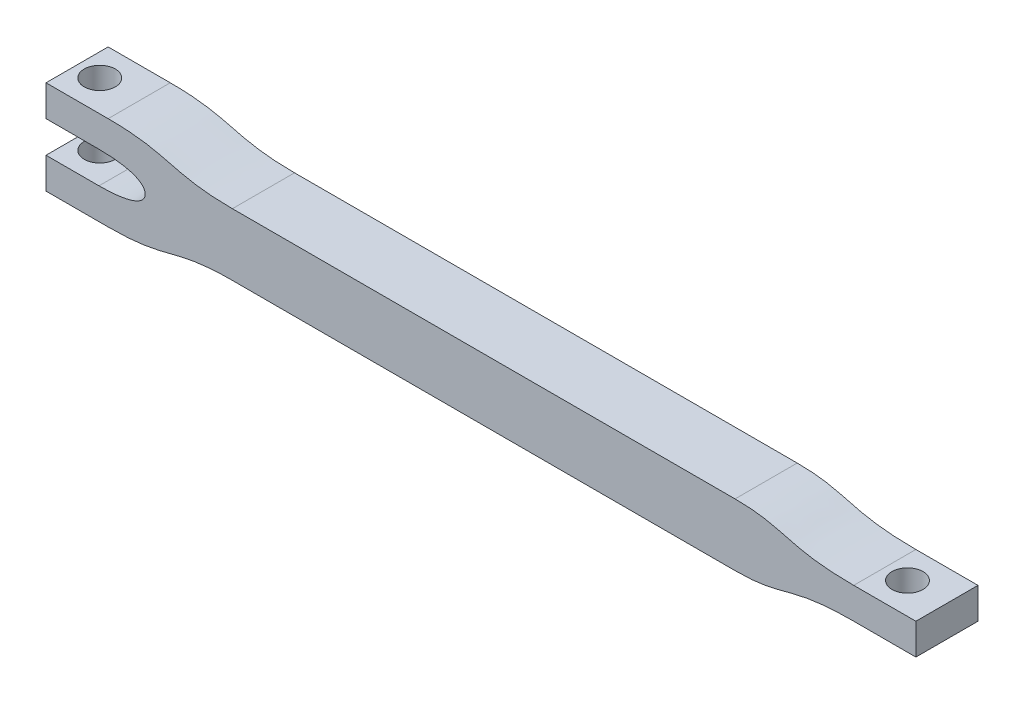
from build123d import *

# Parameters (mm, degrees)
BOSS_EXTRUDE1_DEPTH = 25.4
SKETCH4_R           = 6.35
CUT_EXTRUDE2_DEPTH  = 346.971963311


# Read off the part's stored shape, not the designer's step: Boss-Extrude1
with BuildPart() as part:
    # Boss-Extrude1 outline → Boss-Extrude1 (new body)
    with BuildSketch(Plane.XY):
        with BuildLine():
            Line((268.99238961, 12.7), (63.5, 12.7))
            add(Edge.make_bspline(
                [(63.5, 12.7), (38.1, 12.7), (38.1, 19.177), (12.7, 19.177)],
                knots=[0, 0, 0, 0, 1, 1, 1, 1], degree=3))
            Line((12.7, 19.177), (-12.7, 19.177))
            Line((-12.7, 19.177), (-12.7, 6.477))
            Line((-12.7, 6.477), (8.964128113, 6.477))
            add(Edge.make_bspline(
                [(8.964128113, 6.477), (21.813376256, 6.477), (27.840014766, 3.648672487), (27.840014766, -3.648672487), (21.813376256, -6.477), (8.964128113, -6.477)],
                knots=[0, 0, 0, 0, 1, 1, 2, 2, 2, 2], degree=3))
            Line((8.964128113, -6.477), (-12.7, -6.477))
            Line((-12.7, -6.477), (-12.7, -19.177))
            Line((-12.7, -19.177), (12.7, -19.177))
            add(Edge.make_bspline(
                [(12.7, -19.177), (38.1, -19.177), (38.1, -12.7), (63.5, -12.7)],
                knots=[0, 0, 0, 0, 1, 1, 1, 1], degree=3))
            Line((63.5, -12.7), (268.99238961, -12.7))
            add(Edge.make_bspline(
                [(268.99238961, -12.7), (289.837979728, -12.7), (289.837979728, -6.35), (317.5, -6.35)],
                knots=[0, 0, 0, 0, 1, 1, 1, 1], degree=3))
            Line((317.5, -6.35), (342.9, -6.35))
            Line((342.9, -6.35), (342.9, 6.35))
            Line((342.9, 6.35), (317.5, 6.35))
            add(Edge.make_bspline(
                [(317.5, 6.35), (289.837979728, 6.35), (289.837979728, 12.7), (268.99238961, 12.7)],
                knots=[0, 0, 0, 0, 1, 1, 1, 1], degree=3))
        make_face()
    extrude(amount=BOSS_EXTRUDE1_DEPTH)

    # Sketch4 → Cut-Extrude2 (cut, through all)
    with BuildSketch(Plane(origin=(0, -19.177, 0), x_dir=(-1, 0, 0), z_dir=(0, -1, 0))):
        with Locations(Location((-326.777948506, -12.7, 0), (0, 0, 90))):
            Circle(SKETCH4_R)
        with Locations(Location((3.422051494, -12.7, 0), (0, 0, 180))):
            Circle(SKETCH4_R)
    extrude(amount=-CUT_EXTRUDE2_DEPTH, mode=Mode.SUBTRACT)


solid = part.part
